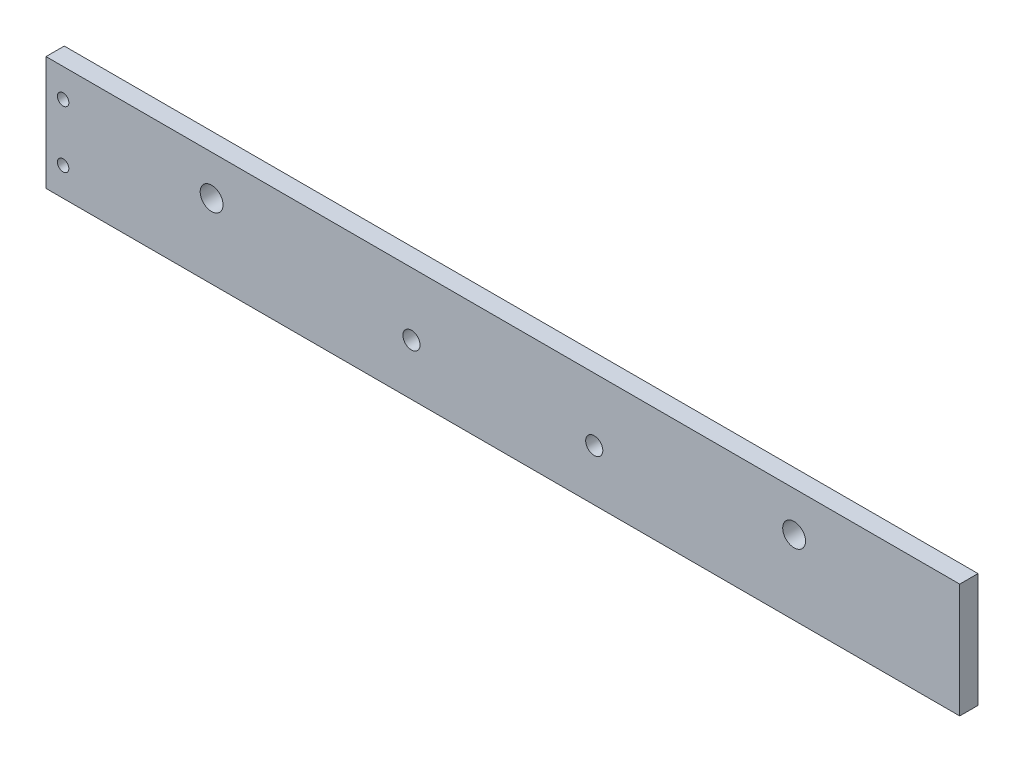
from build123d import *

# Parameters (mm, degrees)
SKETCH2_W               = 160
SKETCH2_H               = 20
BOSS_EXTRUDE1_DEPTH     = 3.2
CUT_EXTRUDE1_DEPTH      = 162.276904732
CUT_EXTRUDE1_DEPTH_BACK = 162.276904732
SKETCH5_R               = 2
SKETCH6_R               = 1.5
CUT_EXTRUDE2_DEPTH      = 10
CUT_EXTRUDE3_DEPTH      = 162.276904732
CUT_EXTRUDE3_DEPTH_BACK = 162.276904732
SKETCH7_R               = 1


with BuildPart() as part:
    # Sketch2 → Boss-Extrude1 (new body)
    with BuildSketch(Plane(origin=(0, -10, 10), x_dir=(1, 0, 0), z_dir=(0, 0, -1))):
        with Locations((80, 0)):
            Rectangle(SKETCH2_W, SKETCH2_H)
    extrude(amount=BOSS_EXTRUDE1_DEPTH)

    # Sketch5 → Cut-Extrude1 (cut, two sides: drawn at the far end of the back side and taken through both)
    with BuildSketch(Plane.XY.offset(10).offset(-CUT_EXTRUDE1_DEPTH_BACK)):
        with Locations((131, -7)):
            Circle(SKETCH5_R)
        with Locations((29, -7)):
            Circle(SKETCH5_R)
    extrude(amount=CUT_EXTRUDE1_DEPTH + CUT_EXTRUDE1_DEPTH_BACK, mode=Mode.SUBTRACT)

    # Sketch6 → Cut-Extrude2 (cut)
    with BuildSketch(Plane.XY.offset(10)):
        with Locations((96, -11)):
            Circle(SKETCH6_R)
        with Locations((64, -11)):
            Circle(SKETCH6_R)
    extrude(amount=-CUT_EXTRUDE2_DEPTH, mode=Mode.SUBTRACT)

    # Sketch7 → Cut-Extrude3 (cut, two sides: drawn at the far end of the back side and taken through both)
    with BuildSketch(Plane.XY.offset(10).offset(-CUT_EXTRUDE3_DEPTH_BACK)):
        with Locations((3, -15)):
            Circle(SKETCH7_R)
        with Locations((3, -5)):
            Circle(SKETCH7_R)
    extrude(amount=CUT_EXTRUDE3_DEPTH + CUT_EXTRUDE3_DEPTH_BACK, mode=Mode.SUBTRACT)


solid = part.part
